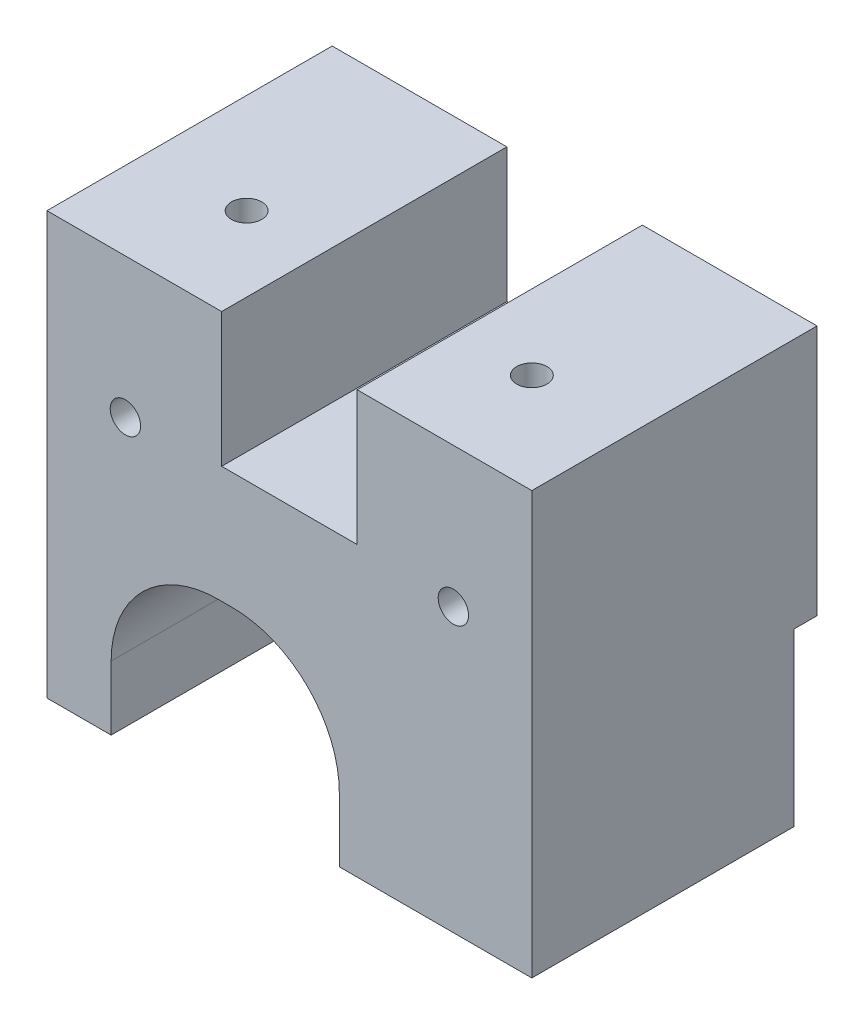
from build123d import *

# Parameters (mm, degrees)
SKETCH1_W                 = 43.18
SKETCH1_H                 = 25.4
BASE_DEPTH                = 37.592
SKETCH2_W                 = 12.065
SKETCH2_H                 = 11.938
LINACTSLOT_DEPTH          = 51.24387091
MOUTINGHOLES_D            = 2.7051
MOUTINGHOLES_DEPTH        = 14.478
MOUTINGHOLES_TIP          = 0.81269403
MOTORSLOT_DEPTH           = 51.24387091
MOTORMOUNTINGHOLES2_D     = 2.2606
MOTORMOUNTINGHOLES2_DEPTH = 11.43
MOTORMOUNTINGHOLES2_TIP   = 0.679152758
F_6_32_TAPPED_HOLE1_D     = 2.7051
F_6_32_TAPPED_HOLE1_DEPTH = 7.62
F_6_32_TAPPED_HOLE1_TIP   = 0.81269403
SKETCH23_W                = 43.18
SKETCH23_H                = 15.24
CUT_EXTRUDE1_DEPTH        = 2.032


with BuildPart() as part:
    # Sketch1 → Base (new body)
    with BuildSketch(Plane(origin=(0, 0, 0), x_dir=(1, 0, 0), z_dir=(0, 1, 0))):
        Rectangle(SKETCH1_W, SKETCH1_H)
    extrude(amount=BASE_DEPTH)

    # Sketch2 → LinActSlot (cut, through all)
    with BuildSketch(Plane.XY.offset(12.7)):
        with Locations((0, 31.623)):
            Rectangle(SKETCH2_W, SKETCH2_H)
    extrude(amount=-LINACTSLOT_DEPTH, mode=Mode.SUBTRACT)

    # MoutingHoles
    with Locations(Plane(origin=(14.160350453, 37.592, 8.373414988), x_dir=(-1, 0, 0), z_dir=(0, 1, 0))):
        with Locations((1.460350453, -4.563414988), (26.860350453, -4.563414988)):
            Hole(MOUTINGHOLES_D / 2, depth=MOUTINGHOLES_DEPTH)
            with Locations((0, 0, -(MOUTINGHOLES_DEPTH + MOUTINGHOLES_TIP / 2))):  # 118° drill point
                Cone(0, MOUTINGHOLES_D / 2, MOUTINGHOLES_TIP, mode=Mode.SUBTRACT)

    # Sketch11 → MotorSlot (cut, through all)
    with BuildSketch(Plane(origin=(0, 0, -12.7), x_dir=(-1, 0, 0), z_dir=(0, 0, -1))):
        with BuildLine():
            Line((15.875, 5.08), (15.875, 5.715))
            ThreePointArc((15.875, 5.715), (13.085192091, 12.450192091), (6.35, 15.24))
            Line((6.35, 15.24), (5.08, 15.24))
            ThreePointArc((5.08, 15.24), (-1.655192091, 12.450192091), (-4.445, 5.715))
            Line((-4.445, 5.715), (-4.445, 5.08))
            Line((-4.445, 5.08), (-4.445, 0))
            Line((-4.445, 0), (15.875, 0))
            Line((15.875, 0), (15.875, 5.08))
        make_face()
    extrude(amount=-MOTORSLOT_DEPTH, mode=Mode.SUBTRACT)

    # MotorMountingHoles2
    with Locations(Plane(origin=(0, 0, -12.7), x_dir=(-1, 0, 0), z_dir=(0, 0, -1))):
        with Locations((18.215, 5.715), (-6.785, 5.715)):
            Hole(MOTORMOUNTINGHOLES2_D / 2, depth=MOTORMOUNTINGHOLES2_DEPTH)
            with Locations((0, 0, -(MOTORMOUNTINGHOLES2_DEPTH + MOTORMOUNTINGHOLES2_TIP / 2))):  # 118° drill point
                Cone(0, MOTORMOUNTINGHOLES2_D / 2, MOTORMOUNTINGHOLES2_TIP, mode=Mode.SUBTRACT)

    # #6-32 Tapped Hole1
    with Locations(Plane.XY.offset(12.7)):
        with Locations((-14.605, 25.146), (14.605, 25.146)):
            Hole(F_6_32_TAPPED_HOLE1_D / 2, depth=F_6_32_TAPPED_HOLE1_DEPTH)
            with Locations((0, 0, -(F_6_32_TAPPED_HOLE1_DEPTH + F_6_32_TAPPED_HOLE1_TIP / 2))):  # 118° drill point
                Cone(0, F_6_32_TAPPED_HOLE1_D / 2, F_6_32_TAPPED_HOLE1_TIP, mode=Mode.SUBTRACT)

    # Sketch23 → Cut-Extrude1 (cut)
    with BuildSketch(Plane(origin=(0, 0, -12.7), x_dir=(-1, 0, 0), z_dir=(0, 0, -1))):
        with Locations((0, 7.62)):
            Rectangle(SKETCH23_W, SKETCH23_H)
    extrude(amount=-CUT_EXTRUDE1_DEPTH, mode=Mode.SUBTRACT)


solid = part.part
